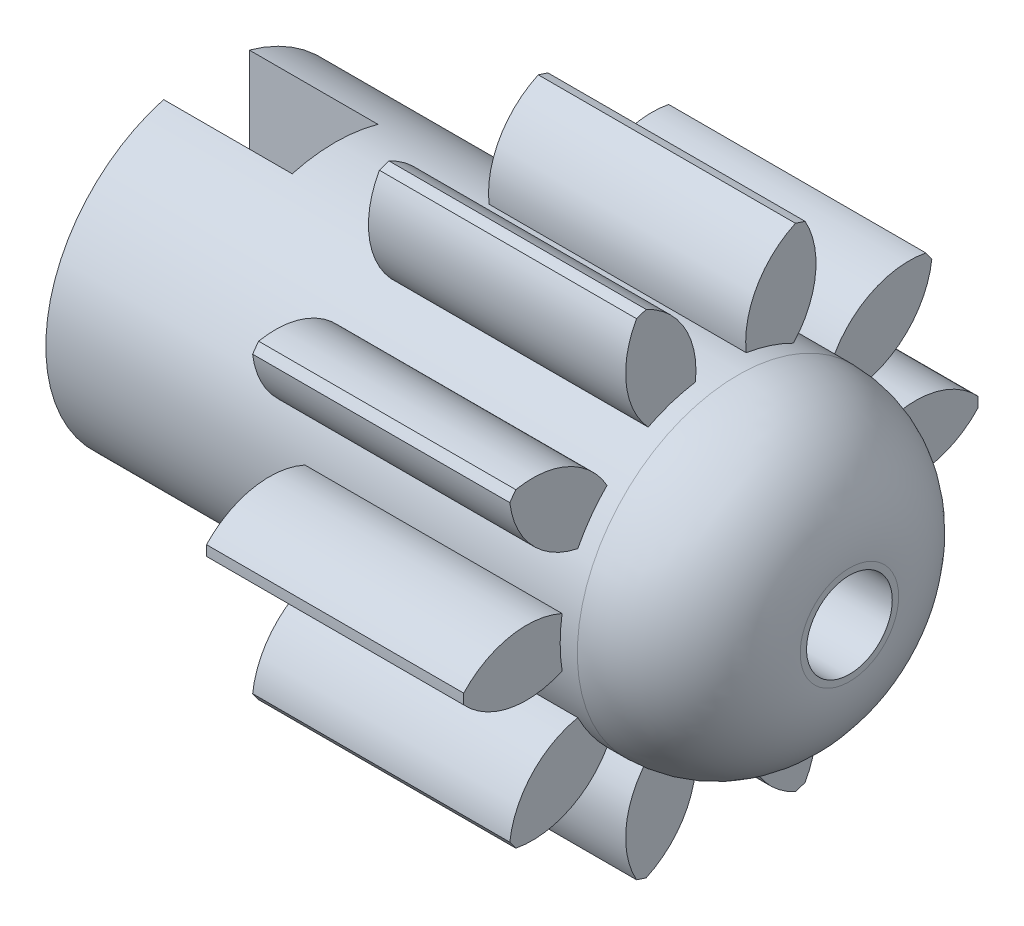
from build123d import *
from build123d.topology import SkipClean

# Parameters (mm, degrees)
BASPROSKE_W         = 3
BASPROSKE_H         = 3
TOOTHCUT_DEPTH      = 6.196152423
TEETHCUTS_COUNT     = 10
TEETHCUTS_ANGLE     = 324
BORSKE_R            = 0.5
BORE_DEPTH          = 50.0000508
SKETCH_1_R          = 1.874
SKETCH_1_R_2        = 0.5
EXTRUDE_1_DEPTH     = 1.5
FILLET_2_R          = 1.3
EXTRUDE_START       = 3
SKETCH_2_R          = 1.874
SKETCH_2_R_2        = 0.5
EXTRUDE_2_DEPTH     = 3
SKETCH_3_W          = 1
SKETCH_3_H          = 3.761306816
CUT_EXTRUDE_1_DEPTH = 1.5


with BuildPart() as part:
    # BasProSke → Base-Revolve (revolve)
    with BuildSketch(Plane(origin=(0, 0, 0), x_dir=(1, 0, 0), z_dir=(0, 1, 0)), mode=Mode.PRIVATE) as base_revolve_sk:
        with Locations((1.5, 1.5)):
            Rectangle(BASPROSKE_W, BASPROSKE_H)
    revolve(base_revolve_sk.sketch.rotate(Axis((-10, 0, 0), (1, 0, 0)), 180), axis=Axis((-10, 0, 0), (1, 0, 0)))

    # TooCutSke → ToothCut (cut, through all)
    with BuildSketch(Plane(origin=(0, 0, 0), x_dir=(0, 0, -1), z_dir=(1, 0, 0))):
        with BuildLine():
            ThreePointArc((0.296449938, 1.850403587), (0, 1.874), (-0.296449938, 1.850403587))
            ThreePointArc((-0.296449938, 1.850403587), (-0.428089565, 2.470295585), (-0.905889751, 2.886591228))
            ThreePointArc((-0.905889751, 2.886591228), (0, 3.0254), (0.905889751, 2.886591228))
            ThreePointArc((0.905889751, 2.886591228), (0.428089565, 2.470295585), (0.296449938, 1.850403587))
        make_face()
    toothcut = extrude(amount=TOOTHCUT_DEPTH, mode=Mode.SUBTRACT)

    # TeethCuts: ToothCut ×10 about axis
    teethcuts_axis = Axis((-10, 0, 0), (1, 0, 0))
    for i in range(1, TEETHCUTS_COUNT):
        add(toothcut.rotate(teethcuts_axis, i * TEETHCUTS_ANGLE / (TEETHCUTS_COUNT - 1)), mode=Mode.SUBTRACT)

    # BorSke → Bore (cut, symmetric)
    with BuildSketch(Plane(origin=(0, 0, 0), x_dir=(0, 0, -1), z_dir=(1, 0, 0))):
        with Locations(Location((0, 0, 0), (0, 0, 180))):
            Circle(BORSKE_R)
    extrude(amount=BORE_DEPTH, both=True, mode=Mode.SUBTRACT)

    # 草图1 → 凸台-拉伸1 (add)
    with SkipClean():  # the faces are left unmerged after this step: merging them gives an invalid solid
        with BuildSketch(Plane(origin=(3, 0, 0), x_dir=(0, 0, -1), z_dir=(1, 0, 0))):
            with Locations(Location((0, 0, 0), (0, 0, 171.101911086))):
                Circle(SKETCH_1_R)
            Circle(SKETCH_1_R_2, mode=Mode.SUBTRACT)
        extrude(amount=EXTRUDE_1_DEPTH)
    add(part.part.scale(1), mode=Mode.REPLACE)  # the faces are merged on a copy

    # 圆角2
    fillet_2_edges = [part.edges().sort_by_distance(p)[0] for p in [
        (4.5, -0.28986551, -1.851446458),
    ]]
    fillet(fillet_2_edges, radius=FILLET_2_R)

    # 草图2 → 凸台-拉伸2 (add)
    with BuildSketch(Plane.ZY.offset(EXTRUDE_START)):
        Circle(SKETCH_2_R)
        Circle(SKETCH_2_R_2, mode=Mode.SUBTRACT)
    extrude(amount=-EXTRUDE_2_DEPTH)

    # 草图3 → 切除-拉伸1 (cut)
    with BuildSketch(Plane.ZY.offset(3)):
        Rectangle(SKETCH_3_W, SKETCH_3_H)
    extrude(amount=-CUT_EXTRUDE_1_DEPTH, mode=Mode.SUBTRACT)


solid = part.part
